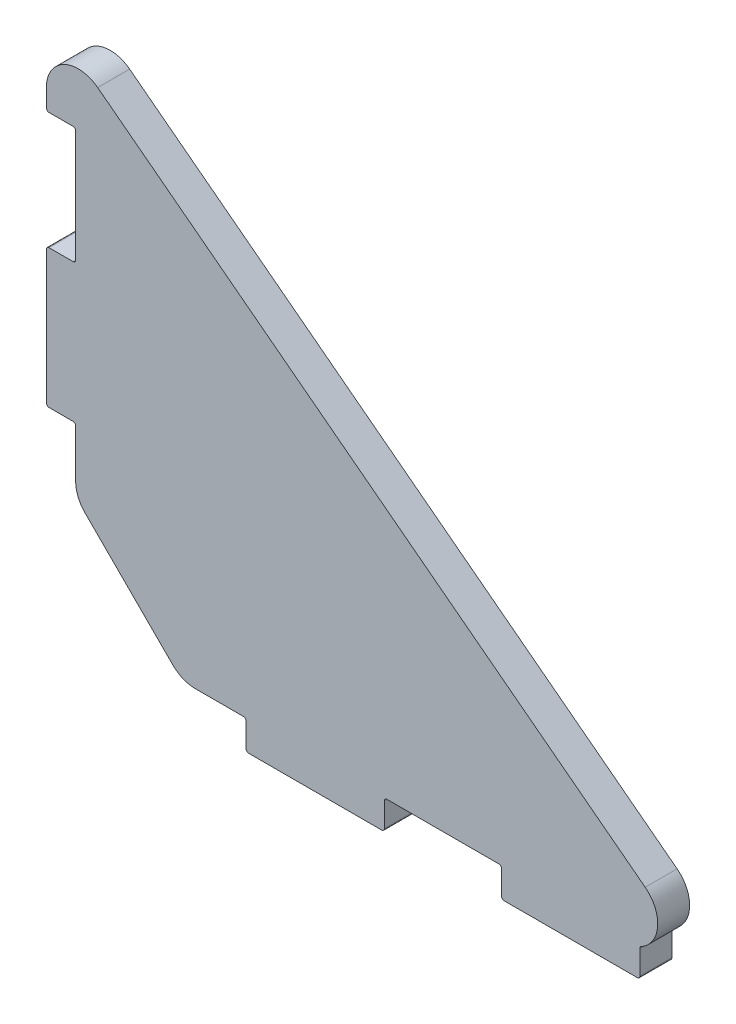
from build123d import *

# Parameters (mm, degrees)
BASE_FLANGE1_DEPTH = 4.7625
FILLET1_R          = 0.396875
FILLET2_R          = 4.7625


# Sheet-metal steps are written as plain solids
with BuildPart() as part:
    # Sketch1 → Base-Flange1 (new body)
    with BuildSketch(Plane.XY):
        Polygon((-4.365625, 76.2), (95.25, 0), (84.1375, 0), (84.1375, -4.365625), (63.5, -4.365625), (63.5, 0), (46.0375, 0), (46.0375, -4.365625), (25.4, -4.365625), (25.4, 0), (15.875, 0), (0, 15.875), (0, 25.4), (-4.365625, 25.4), (-4.365625, 46.0375), (0, 46.0375), (0, 63.5), (-4.365625, 63.5), align=None)
    extrude(amount=-BASE_FLANGE1_DEPTH)

    # Fillet1
    fillet1_edges = [part.edges().sort_by_distance(p)[0] for p in [
        (25.4, 0, -2.38125),
        (0, 25.4, -2.38125),
        (-4.365625, 25.4, -2.38125),
        (-4.365625, 46.0375, -2.38125),
        (0, 46.0375, -2.38125),
        (0, 63.5, -2.38125),
        (-4.365625, 63.5, -2.38125),
        (84.1375, 0, -2.38125),
        (84.1375, -4.365625, -2.38125),
        (63.5, -4.365625, -2.38125),
        (63.5, 0, -2.38125),
        (46.0375, 0, -2.38125),
        (46.0375, -4.365625, -2.38125),
        (25.4, -4.365625, -2.38125),
    ]]
    fillet(fillet1_edges, radius=FILLET1_R)

    # Fillet2
    fillet2_edges = [part.edges().sort_by_distance(p)[0] for p in [
        (95.25, 0, -2.38125),
        (15.875, 0, -2.38125),
        (0, 15.875, -2.38125),
        (-4.365625, 76.2, -2.38125),
    ]]
    fillet(fillet2_edges, radius=FILLET2_R)


solid = part.part
